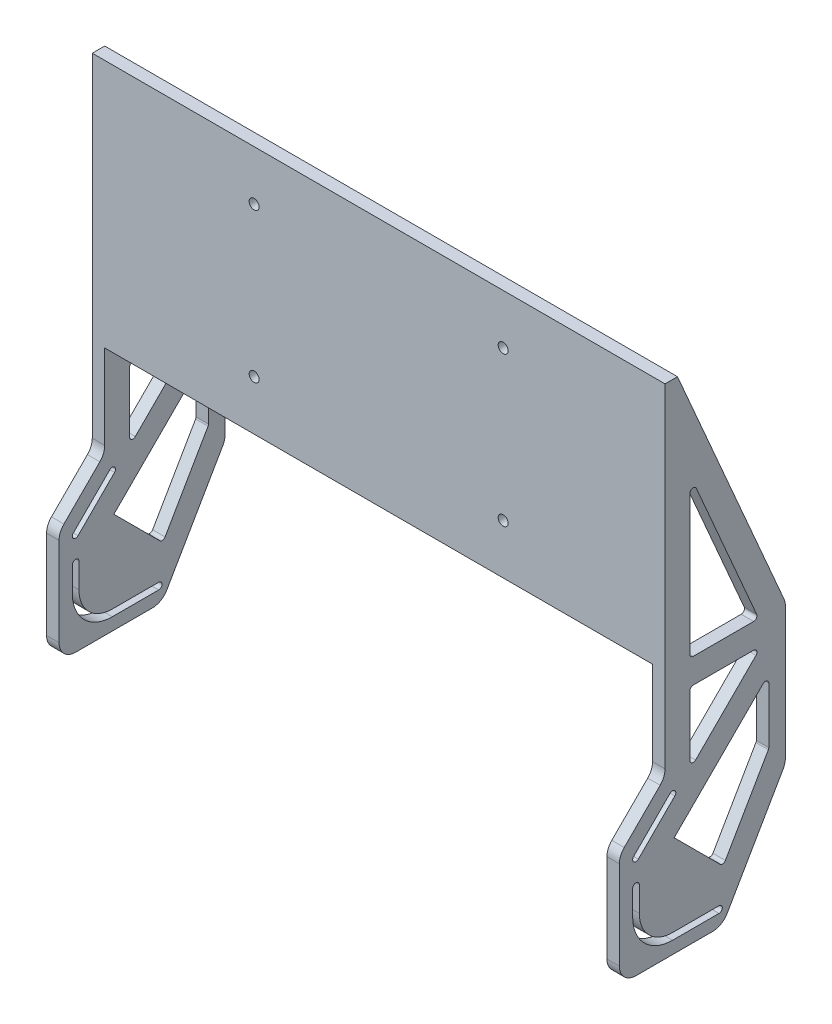
from build123d import *

# Parameters (mm, degrees)
DODANIE_WYCI_GNI_CIE1_DEPTH      = 345
DODANIE_WYCI_GNI_CIE1_DEPTH_BACK = 345
SZKIC1_W                         = 200
SZKIC1_H                         = 600
SZKIC2_R                         = 6
SZKIC2_W                         = 660
SZKIC2_H                         = 300
WYTNIJ_WYCI_GNI_CIE1_DEPTH       = 500.024047517
WYTNIJ_WYCI_GNI_CIE2_DEPTH       = 760.012516366
WYTNIJ_WYCI_GNI_CIE3_DEPTH       = 760.012516366
SZKIC5_W                         = 660
SZKIC5_H                         = 130
WYTNIJ_WYCI_GNI_CIE5_DEPTH       = 469.001068375
ZAOKR_GLENIE1_R                  = 20
LUSTRO1_START                    = 330
LUSTRO1_DEPTH                    = 15
LUSTRO1_2_DEPTH                  = 15


# Read off the part's stored shape, not the designer's step: Lustro1
with BuildPart() as part:
    # Szkic1 → Dodanie-wyciągnięcie1 (new, two sides: drawn at the far end of the back side and taken through both)
    with BuildSketch(Plane(origin=(0, 0, 0), x_dir=(0, 0, -1), z_dir=(1, 0, 0)).offset(-DODANIE_WYCI_GNI_CIE1_DEPTH_BACK)):
        Rectangle(SZKIC1_W, SZKIC1_H)
    extrude(amount=DODANIE_WYCI_GNI_CIE1_DEPTH + DODANIE_WYCI_GNI_CIE1_DEPTH_BACK)

    # Szkic2 → Wytnij-wyciągnięcie1 (cut, through all)
    with BuildSketch(Plane.XY.offset(100)):
        with Locations((-150, 240)):
            Circle(SZKIC2_R)
        with Locations((-150, 60)):
            Circle(SZKIC2_R)
        with Locations((150, 60)):
            Circle(SZKIC2_R)
        with Locations((150, 240)):
            Circle(SZKIC2_R)
        with Locations((0, -150)):
            Rectangle(SZKIC2_W, SZKIC2_H)
    extrude(amount=-WYTNIJ_WYCI_GNI_CIE1_DEPTH, mode=Mode.SUBTRACT)

    # Szkic3 → Wytnij-wyciągnięcie2 (cut, through all)
    with BuildSketch(Plane.ZY.offset(345)):
        Polygon((45, -110), (100, -165), (100, 300), (45, 300), align=None)
        Polygon((30, 300), (-100, 0), (-100, 300), align=None)
    extrude(amount=-WYTNIJ_WYCI_GNI_CIE2_DEPTH, mode=Mode.SUBTRACT)

    # Szkic4 → Wytnij-wyciągnięcie3 (cut, through all)
    with BuildSketch(Plane.ZY.offset(345)):
        with BuildLine():
            Line((-20, -285), (36, -285))
            ThreePointArc((36, -285), (69.941125497, -270.941125497), (84, -237))
            Line((84, -237), (84, -207))
            ThreePointArc((84, -207), (80, -203), (76, -207))
            Line((76, -207), (76, -237))
            ThreePointArc((76, -237), (64.284271247, -265.284271247), (36, -277))
            Line((36, -277), (-20, -277))
            ThreePointArc((-20, -277), (-24, -281), (-20, -285))
        make_face()
        with BuildLine():
            Line((77.171572875, -179.828427125), (33.171572875, -135.828427125))
            ThreePointArc((33.171572875, -135.828427125), (33.171572875, -130.171572875), (38.828427125, -130.171572875))
            Line((38.828427125, -130.171572875), (82.828427125, -174.171572875))
            ThreePointArc((82.828427125, -174.171572875), (82.828427125, -179.828427125), (77.171572875, -179.828427125))
        make_face()
        with BuildLine():
            Line((8.171572875, -110.828427125), (-64.580770724, -38.076083526))
            ThreePointArc((-64.580770724, -38.076083526), (-65.447861729, -33.716922672), (-61.752343599, -31.247656401))
            Line((-61.752343599, -31.247656401), (11, -31.247656401))
            ThreePointArc((11, -31.247656401), (13.828427125, -32.419229276), (15, -35.247656401))
            Line((15, -35.247656401), (15, -108))
            ThreePointArc((15, -108), (12.530733729, -111.69551813), (8.171572875, -110.828427125))
        make_face()
        with BuildLine():
            Line((-61.752343599, -1.247656401), (11, -1.247656401))
            ThreePointArc((11, -1.247656401), (13.828427125, -0.076083526), (15, 2.752343599))
            Line((15, 2.752343599), (15, 170.642367288))
            ThreePointArc((15, 170.642367288), (11.812129914, 174.559055303), (7.329777499, 172.232797039))
            Line((7.329777499, 172.232797039), (-65.4225661, 4.342773349))
            ThreePointArc((-65.4225661, 4.342773349), (-65.096122823, 0.557089514), (-61.752343599, -1.247656401))
        make_face()
        with BuildLine():
            Line((33.95836944, -179.04163056), (-73.171572875, -71.911688245))
            ThreePointArc((-73.171572875, -71.911688245), (-77.530733729, -71.04459724), (-80, -74.74011537))
            Line((-80, -74.74011537), (-80, -141.933358006))
            ThreePointArc((-80, -141.933358006), (-79.863703305, -142.968634187), (-79.464101615, -143.933358006))
            Line((-79.464101615, -143.933358006), (-27.704526957, -233.583571092))
            ThreePointArc((-27.704526957, -233.583571092), (-24.762530111, -235.549350538), (-21.411998217, -234.411998217))
            Line((-21.411998217, -234.411998217), (33.95836944, -179.04163056))
        make_face()
        Polygon((-24, -300), (-100, -168.364138625), (-100, -300), align=None)
    extrude(amount=-WYTNIJ_WYCI_GNI_CIE3_DEPTH, mode=Mode.SUBTRACT)

    # Szkic5 → Wytnij-wyciągnięcie5 (cut, through all)
    with BuildSketch(Plane(origin=(0, 0, 0), x_dir=(1, 0, 0), z_dir=(0, 1, 0))):
        with Locations((0, 35)):
            Rectangle(SZKIC5_W, SZKIC5_H)
    extrude(amount=WYTNIJ_WYCI_GNI_CIE5_DEPTH, mode=Mode.SUBTRACT)

    # Zaokrąglenie1
    zaokr_glenie1_edges = [part.edges().sort_by_distance(p)[0] for p in [
        (-337.5, -300, -24),
        (-337.5, -168.364138625, -100),
        (-337.5, -110, 45),
        (-337.5, -165, 100),
        (-337.5, -300, 100),
        (-337.5, 0, -100),
    ]]
    fillet(zaokr_glenie1_edges, radius=ZAOKR_GLENIE1_R)

    # Lustro1 outline → Lustro1 (cut)
    with BuildSketch(Plane.YZ.offset(LUSTRO1_START)):
        with BuildLine():
            ThreePointArc((3.805124986, -98.351112506), (-0.086374196, -99.583440072), (-4.147023767, -100))
            Line((-4.147023767, -100), (0, -100))
            Line((0, -100), (3.805124986, -98.351112506))
        make_face()
        with BuildLine():
            ThreePointArc((-163.005154776, -100), (-168.181535678, -99.318516526), (-173.005154776, -97.320508076))
            Line((-173.005154776, -97.320508076), (-168.364138625, -100))
            Line((-168.364138625, -100), (-163.005154776, -100))
        make_face()
        with BuildLine():
            ThreePointArc((-290, -29.773502692), (-297.320508076, -22.452994616), (-300, -12.452994616))
            Line((-300, -12.452994616), (-300, -24))
            Line((-300, -24), (-290, -29.773502692))
        make_face()
        with BuildLine():
            ThreePointArc((-300, 80), (-294.142135624, 94.142135624), (-280, 100))
            Line((-280, 100), (-300, 100))
            Line((-300, 100), (-300, 80))
        make_face()
        with BuildLine():
            ThreePointArc((-173.284271247, 100), (-165.6306026, 98.47759065), (-159.142135624, 94.142135624))
            Line((-159.142135624, 94.142135624), (-165, 100))
            Line((-165, 100), (-173.284271247, 100))
        make_face()
    extrude(amount=LUSTRO1_DEPTH, mode=Mode.SUBTRACT)

    # Lustro1 2 outline → Lustro1 2 (add)
    with BuildSketch(Plane.YZ.offset(LUSTRO1_START)):
        with BuildLine():
            ThreePointArc((-101.715728753, 45), (-109.3693974, 46.52240935), (-115.857864376, 50.857864376))
            Line((-115.857864376, 50.857864376), (-110, 45))
            Line((-110, 45), (-101.715728753, 45))
        make_face()
    extrude(amount=LUSTRO1_2_DEPTH)


solid = part.part
